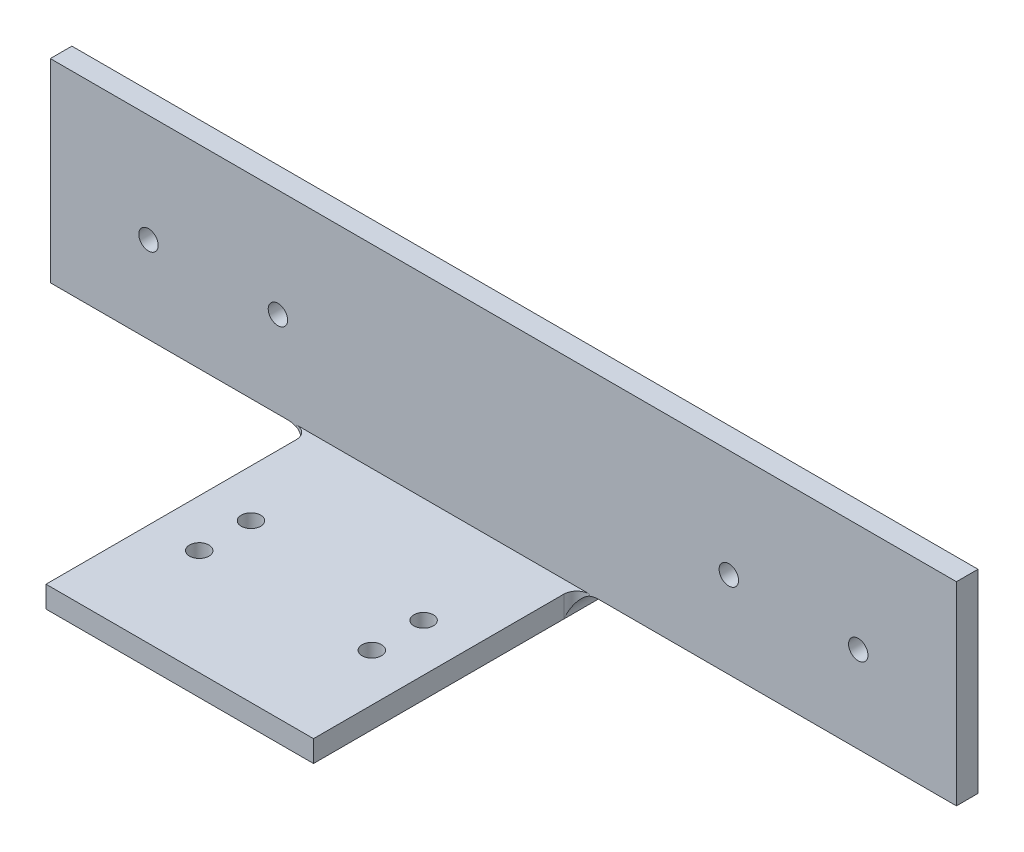
from build123d import *

# Parameters (mm, degrees)
SKETCH_1_W                     = 210
SKETCH_1_H                     = 50
EXTRUDE_1_DEPTH                = 5
SKETCH_3_R                     = 2.25
CUT_EXTRUDE_1_DEPTH            = 5
SKETCH_4_W                     = 210
SKETCH_4_H                     = 5
EXTRUDE_2_DEPTH                = 61
CUT_EXTRUDE_2_REACH            = 227.734
SKETCH_6_W                     = 60
SKETCH_6_H                     = 5
FILLET_1_R                     = 10
CUT_EXTRUDE_3_REACH            = 227.734
SKETCH_7_W                     = 88
SKETCH_7_H                     = 5
FILLET_2_R                     = 10
FILLET_6_R                     = 3
SKETCH_11_R                    = 2.25
CUT_EXTRUDE_4_DEPTH            = 225.67977212
SPLIT_BODIES_2_SURFACE_1_BACK  = 429.084
SPLIT_BODIES_2_SURFACE_1_DEPTH = 858.168
FILLET_8_R                     = 5
FILLET_9_R                     = 3


# Some blends are built 0.0001 mm under size
with BuildPart() as part:
    # 草图1 → 凸台-拉伸1 (new body)
    with BuildSketch(Plane.XY):
        with Locations((105, 25)):
            Rectangle(SKETCH_1_W, SKETCH_1_H)
    extrude_1 = extrude(amount=EXTRUDE_1_DEPTH)

    # 草图3 → 切除-拉伸1 (cut)
    with BuildSketch(Plane.XY.offset(5)):
        with Locations((157.25, 25)):
            Circle(SKETCH_3_R)
        with Locations((187.25, 25)):
            Circle(SKETCH_3_R)
        with Locations(Location((22.75, 25, 0), (0, 0, 180))):
            Circle(SKETCH_3_R)
        with Locations(Location((52.75, 25, 0), (0, 0, 180))):
            Circle(SKETCH_3_R)
    cut_extrude_1 = extrude(amount=-CUT_EXTRUDE_1_DEPTH, mode=Mode.SUBTRACT)

    # 草图4 → 凸台-拉伸2 (add)
    with BuildSketch(Plane.XY.offset(5)):
        with Locations((105, 2.5)):
            Rectangle(SKETCH_4_W, SKETCH_4_H)
    extrude_2 = extrude(amount=EXTRUDE_2_DEPTH)

    # 草图6 → 切除-拉伸2 (cut, up to next)
    with BuildSketch(Plane.XY.offset(66), mode=Mode.PRIVATE) as cut_extrude_2_sk1:
        with Locations((180, 2.5)):
            Rectangle(SKETCH_6_W, SKETCH_6_H)
    cut_extrude_2_tool1 = extrude(cut_extrude_2_sk1.sketch, amount=-CUT_EXTRUDE_2_REACH, mode=Mode.PRIVATE) & part.part
    cut_extrude_2 = cut_extrude_2_tool1.solids().sort_by_distance((180, 2.5, 66))[0]
    add(cut_extrude_2, mode=Mode.SUBTRACT)

    # 圆角1
    # the kernel refuses this fillet: 10 mm, written as the material it adds along each edge
    with BuildSketch(Plane(origin=(150, 5, 0), x_dir=(0, -1, 0), z_dir=(0, 0, 1))) as fillet_1_piece_1:
        with BuildLine():
            CenterArc((10, 8.660254038), FILLET_1_R, 180, 60)
            Line((0, 8.660254038), (0, 0))
            Line((0, 0), (5, 0))
        make_face()
    extrude(amount=5)

    # 草图7 → 切除-拉伸3 (cut, up to next)
    with BuildSketch(Plane.XY.offset(66), mode=Mode.PRIVATE) as cut_extrude_3_sk1:
        with Locations((44, 2.5)):
            Rectangle(SKETCH_7_W, SKETCH_7_H)
    cut_extrude_3_tool1 = extrude(cut_extrude_3_sk1.sketch, amount=-CUT_EXTRUDE_3_REACH, mode=Mode.PRIVATE) & part.part
    cut_extrude_3 = cut_extrude_3_tool1.solids().sort_by_distance((44, 2.5, 66))[0]
    add(cut_extrude_3, mode=Mode.SUBTRACT)

    # 圆角2
    # the kernel refuses this fillet: 10 mm, written as the material it adds along each edge
    with BuildSketch(Plane(origin=(88, 5, 0), x_dir=(0, -1, 0), z_dir=(0, 0, 1))) as fillet_2_piece_1:
        with BuildLine():
            CenterArc((10, -8.660254038), FILLET_2_R, 120, 60)
            Line((0, -8.660254038), (0, 0))
            Line((0, 0), (5, 0))
        make_face()
    extrude(amount=5)

    # 圆角6
    # the kernel refuses this fillet: 3 mm, written as the material it adds along each edge
    with BuildSketch(Plane(origin=(150, 5, 5), x_dir=(1, 0, 0), z_dir=(0, -1, 0))) as fillet_6_piece_1_section:
        with BuildLine():
            CenterArc((FILLET_6_R, FILLET_6_R), FILLET_6_R, 180, 90)
            Line((0, FILLET_6_R), (0, 0))
            Line((0, 0), (FILLET_6_R, 0))
        make_face()
    fillet_6_piece_1 = extrude(amount=5, mode=Mode.PRIVATE)
    fillet_6_piece_1 = fillet_6_piece_1 - Plane(origin=(158.660254038, -5, 5.756133445), x_dir=(0, -1, 0), z_dir=(0, 0, -1)) * Cylinder(10, 22, mode=Mode.PRIVATE)
    add(fillet_6_piece_1)
    with BuildSketch(Plane(origin=(88, 5, 5), x_dir=(-1, 0, 0), z_dir=(0, -1, 0))) as fillet_6_piece_2_section:
        with BuildLine():
            CenterArc((FILLET_6_R, -FILLET_6_R), FILLET_6_R, 90, 90)
            Line((0, -FILLET_6_R), (0, 0))
            Line((0, 0), (FILLET_6_R, 0))
        make_face()
    fillet_6_piece_2 = extrude(amount=5, mode=Mode.PRIVATE)
    fillet_6_piece_2 = fillet_6_piece_2 - Plane(origin=(79.339745962, -5, 5.756136784), x_dir=(0, -1, 0), z_dir=(0, 0, -1)) * Cylinder(10, 22, mode=Mode.PRIVATE)
    add(fillet_6_piece_2)

    # 草图11 → 切除-拉伸4 (cut, through all)
    with BuildSketch(Plane(origin=(0, 5, 0), x_dir=(1, 0, 0), z_dir=(0, 1, 0))):
        with Locations(Location((98.991167509, -29.5, 0), (0, 0, 180))):
            Circle(SKETCH_11_R)
        with Locations(Location((138.991167509, -29.5, 0), (0, 0, 180))):
            Circle(SKETCH_11_R)
        with Locations(Location((98.991167509, -41.5, 0), (0, 0, 180))):
            Circle(SKETCH_11_R)
        with Locations(Location((138.991167509, -41.5, 0), (0, 0, 180))):
            Circle(SKETCH_11_R)
    cut_extrude_4 = extrude(amount=-CUT_EXTRUDE_4_DEPTH, mode=Mode.SUBTRACT)

    # 镜向16: 凸台-拉伸1, 切除-拉伸1, 凸台-拉伸2, 切除-拉伸2, 切除-拉伸3, 切除-拉伸4 across plane
    add(extrude_1.mirror(Plane(origin=(210, 0, 5), x_dir=(0, 0, 1), z_dir=(-1, 0, 0))))
    add(cut_extrude_1.mirror(Plane(origin=(210, 0, 5), x_dir=(0, 0, 1), z_dir=(-1, 0, 0))), mode=Mode.SUBTRACT)
    add(extrude_2.mirror(Plane(origin=(210, 0, 5), x_dir=(0, 0, 1), z_dir=(-1, 0, 0))))
    add(cut_extrude_2.mirror(Plane(origin=(210, 0, 5), x_dir=(0, 0, 1), z_dir=(-1, 0, 0))), mode=Mode.SUBTRACT)
    add(cut_extrude_3.mirror(Plane(origin=(210, 0, 5), x_dir=(0, 0, 1), z_dir=(-1, 0, 0))), mode=Mode.SUBTRACT)
    add(cut_extrude_4.mirror(Plane(origin=(210, 0, 5), x_dir=(0, 0, 1), z_dir=(-1, 0, 0))), mode=Mode.SUBTRACT)

    # Split Bodies 2: cut with a surface, the side it looks to stays
    # Split Bodies 2 surface: a surface, the sketch's curves swept straight by 858.168 mm
    with BuildLine(Plane.XY.offset(5).offset(-SPLIT_BODIES_2_SURFACE_1_BACK), mode=Mode.PRIVATE) as split_bodies_2_surface_1_path:
        Line((210, 50), (210, 0))
    split_bodies_2_surface_1 = Shell.extrude(split_bodies_2_surface_1_path.wire(), (0 * SPLIT_BODIES_2_SURFACE_1_DEPTH, 0 * SPLIT_BODIES_2_SURFACE_1_DEPTH, 1 * SPLIT_BODIES_2_SURFACE_1_DEPTH))
    split(bisect_by=split_bodies_2_surface_1, keep=Keep.TOP)

    # 圆角8
    fillet_8_edges = [part.edges().sort_by_distance(p)[0] for p in [
        (332, 5, 2.5),
        (270, 5, 2.5),
    ]]
    fillet(fillet_8_edges, radius=FILLET_8_R - 0.0001)  # a hair under: the kernel refuses the full size

    # 圆角9
    fillet_9_edges = [part.edges().sort_by_distance(p)[0] for p in [
        (332, 2.50005, 5),
        (270, 2.50005, 5),
    ]]
    fillet(fillet_9_edges, radius=FILLET_9_R)


solid = part.part
